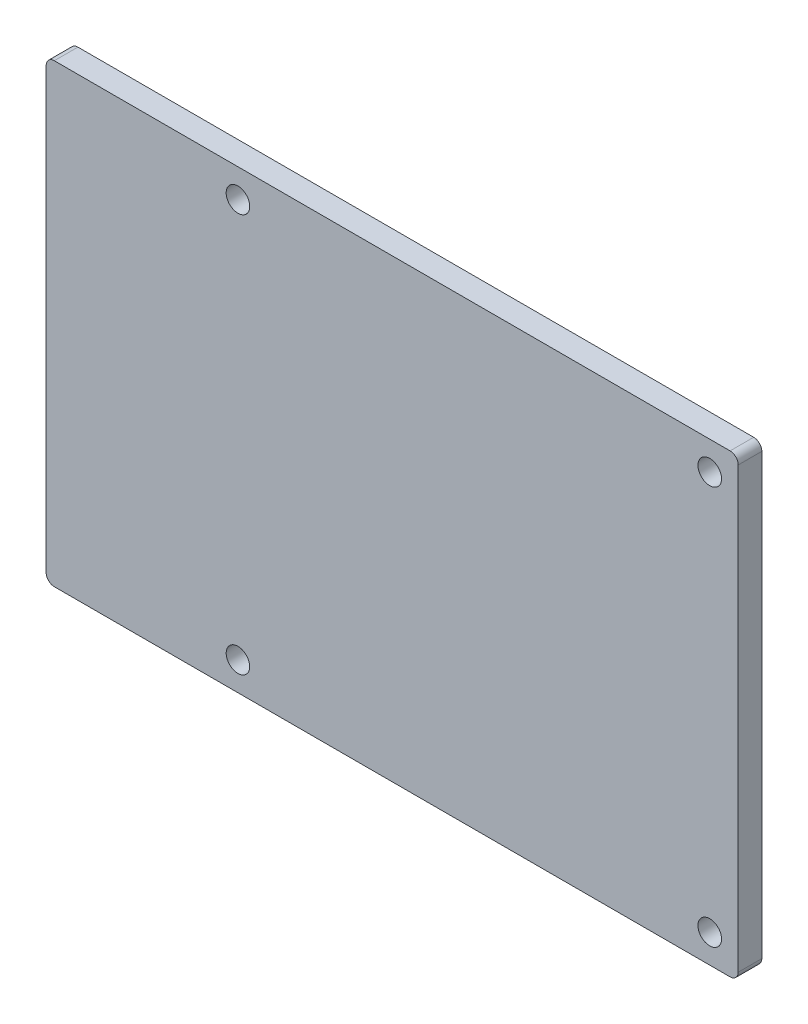
from build123d import *

# Parameters (mm, degrees)
SKETCH1_W           = 85.073492716
SKETCH1_H           = 56
SKETCH1_R           = 1.45
SKETCH1_R_2         = 1.444439883
BOSS_EXTRUDE2_DEPTH = 2.9
FILLET1_R           = 1


with BuildPart() as part:
    # Sketch1 → Boss-Extrude2 (new body)
    with BuildSketch(Plane.XY):
        with Locations((0.5, -16.452272815)):
            Rectangle(SKETCH1_W, SKETCH1_H)
        with Locations((39.536746358, 8.047727185)):
            Circle(SKETCH1_R, mode=Mode.SUBTRACT)
        with Locations((39.536746358, -40.952272815)):
            Circle(SKETCH1_R, mode=Mode.SUBTRACT)
        with Locations((-18.463253642, 8.047727185)):
            Circle(SKETCH1_R, mode=Mode.SUBTRACT)
        with Locations((-18.463253642, -40.952272815)):
            Circle(SKETCH1_R_2, mode=Mode.SUBTRACT)
    extrude(amount=BOSS_EXTRUDE2_DEPTH)

    # Fillet1
    fillet1_edges = [part.edges().sort_by_distance(p)[0] for p in [
        (-42.036746358, 11.547727185, 1.45),
        (43.036746358, 11.547727185, 1.45),
        (-42.036746358, -44.452272815, 1.45),
        (43.036746358, -44.452272815, 1.45),
    ]]
    fillet(fillet1_edges, radius=FILLET1_R)


solid = part.part
